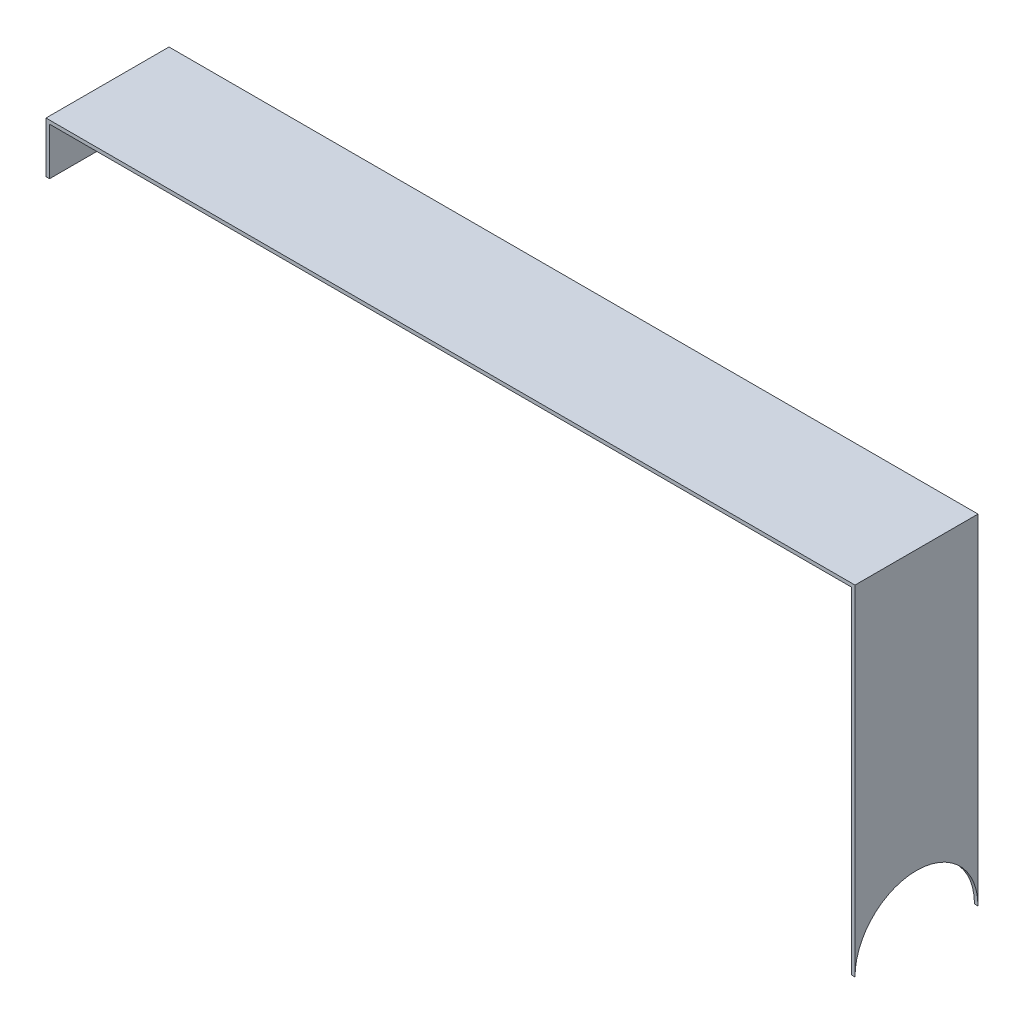
from build123d import *

# Parameters (mm, degrees)
EXTRUDE_1_DEPTH     = 52
SKETCH_2_R          = 26
CUT_EXTRUDE_1_DEPTH = 52


with BuildPart() as part:
    # 草图1 → 凸台-拉伸1 (new body)
    with BuildSketch(Plane.XY):
        Polygon((-37.84512636, 44.347033455), (206.15487364, 44.347033455), (291.15487364, 44.347033455), (291.15487364, -97.652966545), (292.65487364, -97.652966545), (292.65487364, 45.847033455), (-49.34512636, 45.847033455), (-49.34512636, 24.347033455), (-47.84512636, 24.347033455), (-47.84512636, 44.347033455), align=None)
    extrude(amount=EXTRUDE_1_DEPTH)

    # 草图2 → 切除-拉伸1 (cut)
    with BuildSketch(Plane.ZY.offset(-291.15487364)):
        with Locations((26, -97.652966545)):
            Circle(SKETCH_2_R)
    extrude(amount=-CUT_EXTRUDE_1_DEPTH, mode=Mode.SUBTRACT)


solid = part.part
